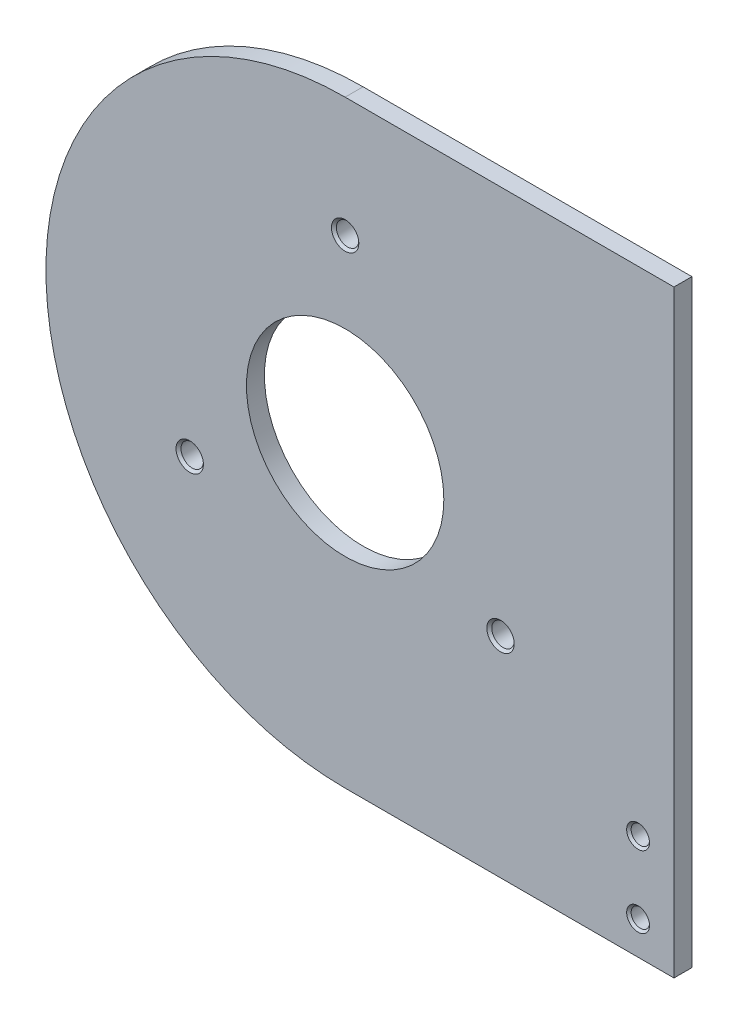
from build123d import *

# Parameters (mm, degrees)
SKETCH_1_W                   = 50
SKETCH_1_H                   = 100
EXTRUDE_1_DEPTH              = 2
SKETCH_2_W                   = 3
SKETCH_2_H                   = 100
EXTRUDE_2_DEPTH              = 80
SKETCH_3_W                   = 2
SKETCH_3_H                   = 66.7
EXTRUDE_3_DEPTH              = 70
CUT_EXTRUDE_4_REACH          = 162.465
SKETCH_8_W                   = 2
SKETCH_8_H                   = 66.7
EXTRUDE_4_DEPTH              = 70
CUT_EXTRUDE_5_REACH          = 140.25
HOLE_WIZARD_M3_1_D           = 2.5
HOLE_WIZARD_M3_1_DEPTH       = 2
HOLE_WIZARD_M3_1_CSINK_D     = 3.05
HOLE_WIZARD_M3_1_CSINK_ANGLE = 90
FILLET_1_R                   = 2
CUT_EXTRUDE_6_REACH          = 140.25
SKETCH_12_R                  = 11
CUT_EXTRUDE_7_REACH          = 162.465
SKETCH_13_R                  = 14.5
SKETCH_14_W                  = 2
SKETCH_14_H                  = 66.7
EXTRUDE_5_DEPTH              = 70
CUT_EXTRUDE_8_REACH          = 156.14
SKETCH_15_R                  = 5.1
CUT_EXTRUDE_9_DEPTH          = 155.140358116
CUT_EXTRUDE_9_DEPTH_BACK     = 155.140358116
SKETCH_19_W                  = 2
SKETCH_19_H                  = 66.7
CUT_EXTRUDE_10_DEPTH         = 119.844436134
FILLET_2_R                   = 2
HOLE_WIZARD_M3_3_D           = 2.5
HOLE_WIZARD_M3_3_CSINK_D     = 3.05
HOLE_WIZARD_M3_3_CSINK_ANGLE = 90
CUT_EXTRUDE_11_DEPTH         = 134.88427839
CUT_EXTRUDE_11_DEPTH_BACK    = 134.88427839


# Read off the part's stored shape, not the designer's step: M1.6 螺纹孔1, M1.6 螺纹孔2, M2.5 螺纹孔1
with BuildPart() as part:
    # 草图1 → 凸台-拉伸1 (new body)
    with BuildSketch(Plane(origin=(0, 0, 0), x_dir=(1, 0, 0), z_dir=(0, 1, 0))):
        Rectangle(SKETCH_1_W, SKETCH_1_H)
    extrude(amount=EXTRUDE_1_DEPTH)

    # 草图2 → 凸台-拉伸2 (add)
    with BuildSketch(Plane(origin=(0, 2, 0), x_dir=(1, 0, 0), z_dir=(0, 1, 0))):
        with Locations((-23.5, 0)):
            Rectangle(SKETCH_2_W, SKETCH_2_H)
    extrude(amount=EXTRUDE_2_DEPTH)

    # 草图3 → 凸台-拉伸3 (add)
    with BuildSketch(Plane.ZY.offset(25)):
        with Locations((-49, 48.65)):
            Rectangle(SKETCH_3_W, SKETCH_3_H)
    extrude(amount=EXTRUDE_3_DEPTH)

    # 草图4 → 切除-拉伸4 (cut, up to next)
    with BuildSketch(Plane(origin=(0, 0, -50), x_dir=(-1, 0, 0), z_dir=(0, 0, -1)), mode=Mode.PRIVATE) as cut_extrude_4_sk1:
        with BuildLine():
            Line((95, 82), (61.65, 82))
            ThreePointArc((61.65, 82), (85.232011153, 72.232011153), (95, 48.65))
            Line((95, 48.65), (95, 82))
        make_face()
    cut_extrude_4_tool1 = extrude(cut_extrude_4_sk1.sketch, amount=-CUT_EXTRUDE_4_REACH, mode=Mode.PRIVATE) & part.part
    # 草图4 → 切除-拉伸4 (cut, up to next)
    with BuildSketch(Plane(origin=(0, 0, -50), x_dir=(-1, 0, 0), z_dir=(0, 0, -1)), mode=Mode.PRIVATE) as cut_extrude_4_sk2:
        with BuildLine():
            ThreePointArc((95, 48.65), (85.232011153, 25.067988847), (61.65, 15.3))
            Line((61.65, 15.3), (95, 15.3))
            Line((95, 15.3), (95, 48.65))
        make_face()
    cut_extrude_4_tool2 = extrude(cut_extrude_4_sk2.sketch, amount=-CUT_EXTRUDE_4_REACH, mode=Mode.PRIVATE) & part.part
    add(cut_extrude_4_tool1.solids().sort_by_distance((-87.550679, 74.550679, -50))[0], mode=Mode.SUBTRACT)
    add(cut_extrude_4_tool2.solids().sort_by_distance((-87.550679, 22.749321, -50))[0], mode=Mode.SUBTRACT)

    # 草图8 → 凸台-拉伸4 (add)
    with BuildSketch(Plane.ZY.offset(25)):
        with Locations((7, 48.65)):
            Rectangle(SKETCH_8_W, SKETCH_8_H)
    extrude(amount=EXTRUDE_4_DEPTH)

    # 草图9 → 切除-拉伸5 (cut, up to next)
    with BuildSketch(Plane.XY.offset(8), mode=Mode.PRIVATE) as cut_extrude_5_sk1:
        with BuildLine():
            ThreePointArc((-95, 48.65), (-85.232011153, 72.232011153), (-61.65, 82))
            Line((-61.65, 82), (-95, 82))
            Line((-95, 82), (-95, 48.65))
        make_face()
    cut_extrude_5_tool1 = extrude(cut_extrude_5_sk1.sketch, amount=-CUT_EXTRUDE_5_REACH, mode=Mode.PRIVATE) & part.part
    # 草图9 → 切除-拉伸5 (cut, up to next)
    with BuildSketch(Plane.XY.offset(8), mode=Mode.PRIVATE) as cut_extrude_5_sk2:
        with BuildLine():
            ThreePointArc((-61.65, 15.3), (-85.232011153, 25.067988847), (-95, 48.65))
            Line((-95, 48.65), (-95, 15.3))
            Line((-95, 15.3), (-61.65, 15.3))
        make_face()
    cut_extrude_5_tool2 = extrude(cut_extrude_5_sk2.sketch, amount=-CUT_EXTRUDE_5_REACH, mode=Mode.PRIVATE) & part.part
    add(cut_extrude_5_tool1.solids().sort_by_distance((-87.550679, 74.550679, 8))[0], mode=Mode.SUBTRACT)
    add(cut_extrude_5_tool2.solids().sort_by_distance((-87.550679, 22.749321, 8))[0], mode=Mode.SUBTRACT)

    # M3 螺纹孔1
    with Locations(Plane.XY.offset(8)):
        with Locations((-78.970508076, 38.65), (-61.65, 68.65), (-44.329491924, 38.65)):
            CounterSinkHole(HOLE_WIZARD_M3_1_D / 2, HOLE_WIZARD_M3_1_CSINK_D / 2, depth=HOLE_WIZARD_M3_1_DEPTH, counter_sink_angle=HOLE_WIZARD_M3_1_CSINK_ANGLE)

    # 圆角1
    fillet_1_edges = [part.edges().sort_by_distance(p)[0] for p in [
        (-23.5, 82, 50),
        (25, 1, 50),
        (25, 1, -50),
    ]]
    fillet(fillet_1_edges, radius=FILLET_1_R)

    # 草图12 → 切除-拉伸6 (cut, up to next)
    with BuildSketch(Plane.XY.offset(8), mode=Mode.PRIVATE) as cut_extrude_6_sk1:
        with Locations((-61.65, 48.65)):
            Circle(SKETCH_12_R)
    cut_extrude_6_tool1 = extrude(cut_extrude_6_sk1.sketch, amount=-CUT_EXTRUDE_6_REACH, mode=Mode.PRIVATE) & part.part
    add(cut_extrude_6_tool1.solids().sort_by_distance((-61.65, 48.65, 8))[0], mode=Mode.SUBTRACT)

    # 草图13 → 切除-拉伸7 (cut, up to next)
    with BuildSketch(Plane(origin=(0, 0, -50), x_dir=(-1, 0, 0), z_dir=(0, 0, -1)), mode=Mode.PRIVATE) as cut_extrude_7_sk1:
        with Locations((61.65, 48.65)):
            Circle(SKETCH_13_R)
    cut_extrude_7_tool1 = extrude(cut_extrude_7_sk1.sketch, amount=-CUT_EXTRUDE_7_REACH, mode=Mode.PRIVATE) & part.part
    add(cut_extrude_7_tool1.solids().sort_by_distance((-61.65, 48.65, -50))[0], mode=Mode.SUBTRACT)

    # 草图14 → 凸台-拉伸5 (add)
    with BuildSketch(Plane.ZY.offset(25)):
        with Locations((-38.5, 48.65)):
            Rectangle(SKETCH_14_W, SKETCH_14_H)
    extrude(amount=EXTRUDE_5_DEPTH)

    # 草图15 → 切除-拉伸8 (cut, up to next)
    with BuildSketch(Plane(origin=(0, 0, -39.5), x_dir=(-1, 0, 0), z_dir=(0, 0, -1)), mode=Mode.PRIVATE) as cut_extrude_8_sk1:
        with Locations(Location((61.65, 48.65, 0), (0, 0, 90))):
            Circle(SKETCH_15_R)
    cut_extrude_8_tool1 = extrude(cut_extrude_8_sk1.sketch, amount=-CUT_EXTRUDE_8_REACH, mode=Mode.PRIVATE) & part.part
    add(cut_extrude_8_tool1.solids().sort_by_distance((-61.65, 48.65, -39.5))[0], mode=Mode.SUBTRACT)

    # 草图18 → 切除-拉伸9 (cut, two sides: drawn at the far end of the back side and taken through both)
    with BuildSketch(Plane(origin=(0, 0, -39.5), x_dir=(-1, 0, 0), z_dir=(0, 0, -1)).offset(-CUT_EXTRUDE_9_DEPTH_BACK)):
        with BuildLine():
            Line((95, 15.3), (95, 48.65))
            ThreePointArc((95, 48.65), (85.232011153, 25.067988847), (61.65, 15.3))
            Line((61.65, 15.3), (95, 15.3))
        make_face()
        with BuildLine():
            Line((95, 48.65), (95, 82))
            Line((95, 82), (61.65, 82))
            ThreePointArc((61.65, 82), (85.232011153, 72.232011153), (95, 48.65))
        make_face()
    extrude(amount=CUT_EXTRUDE_9_DEPTH + CUT_EXTRUDE_9_DEPTH_BACK, mode=Mode.SUBTRACT)

    # 草图19 → 切除-拉伸10 (cut, through all)
    with BuildSketch(Plane.ZY.offset(25)):
        with Locations((-49, 48.65)):
            Rectangle(SKETCH_19_W, SKETCH_19_H)
    extrude(amount=CUT_EXTRUDE_10_DEPTH, mode=Mode.SUBTRACT)

    # 圆角2
    fillet_2_edges = [part.edges().sort_by_distance(p)[0] for p in [
        (-23.5, 82, -50),
    ]]
    fillet(fillet_2_edges, radius=FILLET_2_R)

    # M3 螺纹孔3 (through all)
    with Locations(Plane(origin=(0, 2, 0), x_dir=(1, 0, 0), z_dir=(0, 1, 0))):
        with Locations((-2.7, 0), (21, 10), (21, -10)):
            CounterSinkHole(HOLE_WIZARD_M3_3_D / 2, HOLE_WIZARD_M3_3_CSINK_D / 2, counter_sink_angle=HOLE_WIZARD_M3_3_CSINK_ANGLE)

    # M1.6 螺纹孔1 outline → M1.6 螺纹孔1 (revolve, cut)
    with BuildSketch(Plane(origin=(10, 0, -28), x_dir=(1, 0, 0), z_dir=(0, 0, 1))):
        Polygon((0, 0), (0.625, 0), (0.625, 1.8), (0.825, 2), (0, 2), align=None)
    revolve(axis=Axis((10, 0, -28), (0, 1, 0)), mode=Mode.SUBTRACT)

    # Hole Wizard M1.6 _1 2 outline → Hole Wizard M1.6 _1 2 (revolve, cut)
    with BuildSketch(Plane(origin=(6.4, 0, -28), x_dir=(1, 0, 0), z_dir=(0, 0, 1))):
        Polygon((0, 0), (0.625, 0), (0.625, 1.8), (0.825, 2), (0, 2), align=None)
    revolve(axis=Axis((6.4, 0, -28), (0, 1, 0)), mode=Mode.SUBTRACT)

    # M1.6 螺纹孔2 outline → M1.6 螺纹孔2 (revolve, cut)
    with BuildSketch(Plane(origin=(10, 0, -22), x_dir=(1, 0, 0), z_dir=(0, 0, 1))):
        Polygon((0, 0), (0.625, 0), (0.625, 1.8), (0.825, 2), (0, 2), align=None)
    revolve(axis=Axis((10, 0, -22), (0, 1, 0)), mode=Mode.SUBTRACT)

    # Hole Wizard M1.6 _2 2 outline → Hole Wizard M1.6 _2 2 (revolve, cut)
    with BuildSketch(Plane(origin=(6.4, 0, -22), x_dir=(1, 0, 0), z_dir=(0, 0, 1))):
        Polygon((0, 0), (0.625, 0), (0.625, 1.8), (0.825, 2), (0, 2), align=None)
    revolve(axis=Axis((6.4, 0, -22), (0, 1, 0)), mode=Mode.SUBTRACT)

    # 草图28 → 切除-拉伸11 (cut, two sides: drawn at the far end of the back side and taken through both)
    with BuildSketch(Plane(origin=(0, 2, 0), x_dir=(1, 0, 0), z_dir=(0, 1, 0)).offset(-CUT_EXTRUDE_11_DEPTH_BACK)):
        Polygon((-25, 37.5), (-95, 37.5), (-95, 39.5), (-25, 39.5), (-25, 50), (25, 50), (25, -50), (-25, -50), align=None)
    extrude(amount=CUT_EXTRUDE_11_DEPTH + CUT_EXTRUDE_11_DEPTH_BACK, mode=Mode.SUBTRACT)

    # M2.5 螺纹孔1 outline → M2.5 螺纹孔1 (revolve, cut)
    with BuildSketch(Plane(origin=(-29, 19, 0), x_dir=(1, 0, 0), z_dir=(0, -1, 0))):
        Polygon((0, 6), (1.025, 6), (1.025, 7.75), (1.275, 8), (0, 8), align=None)
    revolve(axis=Axis((-29, 19, 0), (0, 0, 1)), mode=Mode.SUBTRACT)

    # Hole Wizard M2.5 _1 2 outline → Hole Wizard M2.5 _1 2 (revolve, cut)
    with BuildSketch(Plane(origin=(-29, 27, 0), x_dir=(1, 0, 0), z_dir=(0, -1, 0))):
        Polygon((0, 6), (1.025, 6), (1.025, 7.75), (1.275, 8), (0, 8), align=None)
    revolve(axis=Axis((-29, 27, 0), (0, 0, 1)), mode=Mode.SUBTRACT)


solid = part.part
